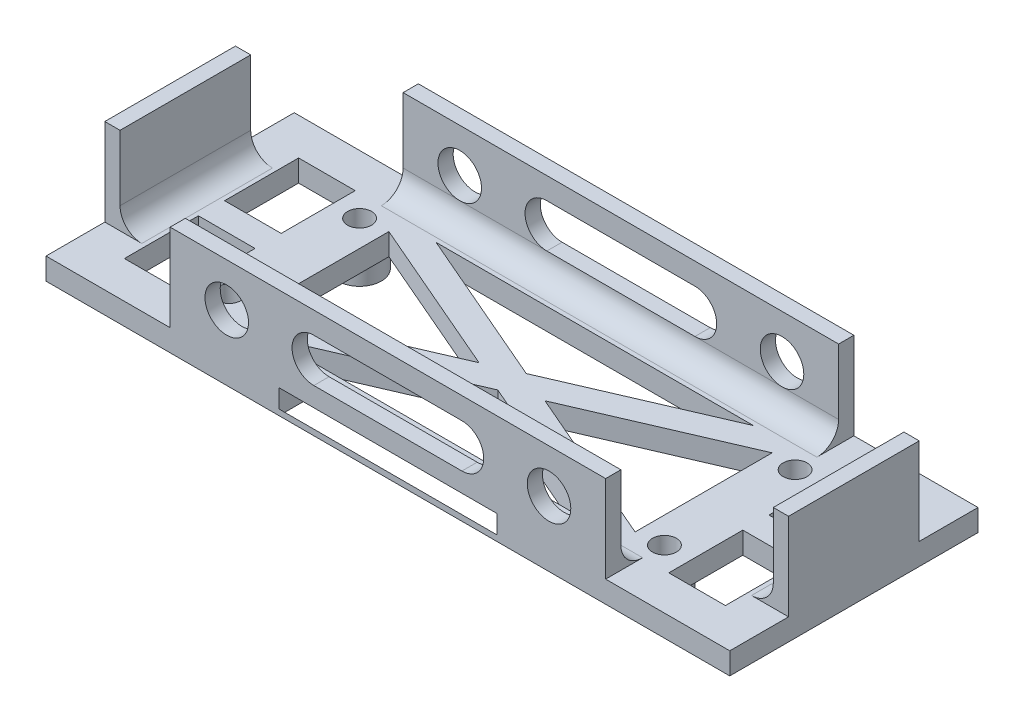
from build123d import *

# Parameters (mm, degrees)
SKETCH_1_W           = 160
SKETCH_1_H           = 64
EXTRUDE_1_DEPTH      = 5
SKETCH_2_W           = 100
SKETCH_2_H           = 7
SKETCH_2_W_2         = 5
SKETCH_2_H_2         = 30
EXTRUDE_2_DEPTH      = 20
FILLET_1_R           = 5
SKETCH_3_R           = 5
SKETCH_3_R_2         = 1.7
EXTRUDE_3_DEPTH      = 5
SKETCH_4_R           = 2.75
CUT_EXTRUDE_1_DEPTH  = 5
SKETCH_5_W           = 160
SKETCH_5_H           = 2
CUT_EXTRUDE_2_DEPTH  = 64
CUT_EXTRUDE_3_DEPTH  = 7
SKETCH_7_W           = 13
SKETCH_7_H           = 17
CUT_EXTRUDE_4_DEPTH  = 7
SKETCH_8_R           = 5
CUT_EXTRUDE_5_DEPTH  = 67
CUT_EXTRUDE_6_DEPTH  = 1
CUT_EXTRUDE_START    = -9
SKETCH_10_W          = 50
SKETCH_10_H          = 3
CUT_EXTRUDE_7_DEPTH  = 24
SKETCH_12_W          = 160
SKETCH_12_H          = 1.5
CUT_EXTRUDE_11_DEPTH = 34
SKETCH_13_W          = 1.5
SKETCH_13_H          = 57
CUT_EXTRUDE_12_DEPTH = 34
FILLET_2_R           = 1


with BuildPart() as part:
    # 草图1 → 凸台-拉伸1 (new body)
    with BuildSketch(Plane(origin=(0, 0, 0), x_dir=(1, 0, 0), z_dir=(0, 1, 0))):
        with Locations((80, 32)):
            Rectangle(SKETCH_1_W, SKETCH_1_H)
    extrude(amount=EXTRUDE_1_DEPTH)

    # 草图2 → 凸台-拉伸2 (add)
    with BuildSketch(Plane(origin=(0, 5, 0), x_dir=(1, 0, 0), z_dir=(0, 1, 0))):
        with Locations((80, 60.5)):
            Rectangle(SKETCH_2_W, SKETCH_2_H)
        with Locations((157.5, 32)):
            Rectangle(SKETCH_2_W_2, SKETCH_2_H_2)
        with Locations((2.5, 32)):
            Rectangle(SKETCH_2_W_2, SKETCH_2_H_2)
        with Locations((80, 3.5)):
            Rectangle(SKETCH_2_W, SKETCH_2_H)
    extrude(amount=EXTRUDE_2_DEPTH)

    # 圆角1
    fillet_1_edges = [part.edges().sort_by_distance(p)[0] for p in [
        (80, 5, -57),
        (155, 5, -32),
        (5, 5, -32),
        (80, 5, -7),
    ]]
    fillet(fillet_1_edges, radius=FILLET_1_R)

    # 草图3 → 凸台-拉伸3 (add)
    # profile 1 of 4: a face of its own
    with BuildSketch(Plane.XZ):
        with Locations(Location((130, -17, 0), (0, 0, 270))):
            Circle(SKETCH_3_R)
        with Locations(Location((130, -17, 0), (0, 0, 270))):
            Circle(SKETCH_3_R_2, mode=Mode.SUBTRACT)
    # profile 2 of 4: a face of its own
    with BuildSketch(Plane.XZ):
        with Locations(Location((130, -47, 0), (0, 0, 270))):
            Circle(SKETCH_3_R)
        with Locations(Location((130, -47, 0), (0, 0, 270))):
            Circle(SKETCH_3_R_2, mode=Mode.SUBTRACT)
    # profile 3 of 4: a face of its own
    with BuildSketch(Plane.XZ):
        with Locations(Location((30, -47, 0), (0, 0, 270))):
            Circle(SKETCH_3_R)
        with Locations(Location((30, -47, 0), (0, 0, 270))):
            Circle(SKETCH_3_R_2, mode=Mode.SUBTRACT)
    # profile 4 of 4: a face of its own
    with BuildSketch(Plane.XZ):
        with Locations(Location((30, -17, 0), (0, 0, 270))):
            Circle(SKETCH_3_R)
        with Locations(Location((30, -17, 0), (0, 0, 270))):
            Circle(SKETCH_3_R_2, mode=Mode.SUBTRACT)
    extrude(amount=EXTRUDE_3_DEPTH)

    # 草图4 → 切除-拉伸1 (cut)
    with BuildSketch(Plane(origin=(0, 5, 0), x_dir=(1, 0, 0), z_dir=(0, 1, 0))):
        with Locations(Location((130, 17, 0), (0, 0, 270))):
            Circle(SKETCH_4_R)
        with Locations(Location((130, 47, 0), (0, 0, 270))):
            Circle(SKETCH_4_R)
        with Locations(Location((30, 17, 0), (0, 0, 270))):
            Circle(SKETCH_4_R)
        with Locations(Location((30, 47, 0), (0, 0, 270))):
            Circle(SKETCH_4_R)
    extrude(amount=-CUT_EXTRUDE_1_DEPTH, mode=Mode.SUBTRACT)

    # 草图5 → 切除-拉伸2 (cut)
    with BuildSketch(Plane(origin=(0, 25, 0), x_dir=(1, 0, 0), z_dir=(0, 1, 0))):
        with Locations((80, 63)):
            Rectangle(SKETCH_5_W, SKETCH_5_H)
        with Locations((80, 1)):
            Rectangle(SKETCH_5_W, SKETCH_5_H)
    extrude(amount=-CUT_EXTRUDE_2_DEPTH, mode=Mode.SUBTRACT)

    # 草图6 → 切除-拉伸3 (cut)
    with BuildSketch(Plane.XZ):
        Polygon((43.567425452, -51), (116.432574548, -51), (80, -35.2677519), align=None)
        Polygon((36, -47.7322481), (36, -16.2677519), (72.432574548, -32), align=None)
        Polygon((43.567425452, -13), (116.432574548, -13), (80, -28.7322481), align=None)
        Polygon((124, -47.7322481), (124, -16.2677519), (87.567425452, -32), align=None)
    extrude(amount=-CUT_EXTRUDE_3_DEPTH, mode=Mode.SUBTRACT)

    # 草图7 → 切除-拉伸4 (cut)
    with BuildSketch(Plane(origin=(0, 5, 0), x_dir=(1, 0, 0), z_dir=(0, 1, 0))):
        with Locations((17.5, 43.5)):
            Rectangle(SKETCH_7_W, SKETCH_7_H)
        with Locations((17.5, 20.5)):
            Rectangle(SKETCH_7_W, SKETCH_7_H)
        with Locations((142.5, 43.5)):
            Rectangle(SKETCH_7_W, SKETCH_7_H)
        with Locations((142.5, 20.5)):
            Rectangle(SKETCH_7_W, SKETCH_7_H)
    extrude(amount=-CUT_EXTRUDE_4_DEPTH, mode=Mode.SUBTRACT)

    # 草图8 → 切除-拉伸5 (cut)
    with BuildSketch(Plane.XY.offset(-2)):
        with Locations((43, 15)):
            Circle(SKETCH_8_R)
        with Locations((117, 15)):
            Circle(SKETCH_8_R)
        with BuildLine():
            Line((63, 20), (97, 20))
            ThreePointArc((97, 20), (102, 15), (97, 10))
            Line((97, 10), (63, 10))
            ThreePointArc((63, 10), (58, 15), (63, 20))
        make_face()
    extrude(amount=-CUT_EXTRUDE_5_DEPTH, mode=Mode.SUBTRACT)

    # 草图9 → 切除-拉伸6 (cut)
    with BuildSketch(Plane(origin=(160, 0, 0), x_dir=(0, 0, -1), z_dir=(1, 0, 0))):
        Polygon((2, 4.416741909), (2.583258091, 5), (2, 5), align=None)
    extrude(amount=-CUT_EXTRUDE_6_DEPTH, mode=Mode.SUBTRACT)

    # 草图10 → 切除-拉伸7 (cut)
    with BuildSketch(Plane(origin=(0, 1.208370955, 1.208370955), x_dir=(1, 0, 0), z_dir=(0, 0.7071067811865486, 0.7071067811865465)).offset(CUT_EXTRUDE_START)):
        with Locations((80, 4.914213562)):
            Rectangle(SKETCH_10_W, SKETCH_10_H)
    cut_extrude_7 = extrude(amount=CUT_EXTRUDE_7_DEPTH, mode=Mode.SUBTRACT)

    # 镜向1: 切除-拉伸7 across plane
    add(cut_extrude_7.mirror(Plane.XY.offset(-32)), mode=Mode.SUBTRACT)

    # 草图12 → 切除-拉伸11 (cut)
    with BuildSketch(Plane.XZ):
        with Locations((80, -2.75)):
            Rectangle(SKETCH_12_W, SKETCH_12_H)
        with Locations((80, -61.25)):
            Rectangle(SKETCH_12_W, SKETCH_12_H)
    extrude(amount=-CUT_EXTRUDE_11_DEPTH, mode=Mode.SUBTRACT)

    # 草图13 → 切除-拉伸12 (cut)
    with BuildSketch(Plane.XZ):
        with Locations((159.25, -32)):
            Rectangle(SKETCH_13_W, SKETCH_13_H)
        with Locations((0.75, -32)):
            Rectangle(SKETCH_13_W, SKETCH_13_H)
    extrude(amount=-CUT_EXTRUDE_12_DEPTH, mode=Mode.SUBTRACT)

    # 圆角2
    fillet_2_edges = [part.edges().sort_by_distance(p)[0] for p in [
        (130, 0, -12),
        (130, 0, -42),
        (30, 0, -42),
        (30, 0, -12),
    ]]
    fillet(fillet_2_edges, radius=FILLET_2_R - 0.0001)  # a hair under: the kernel refuses the full size


solid = part.part
